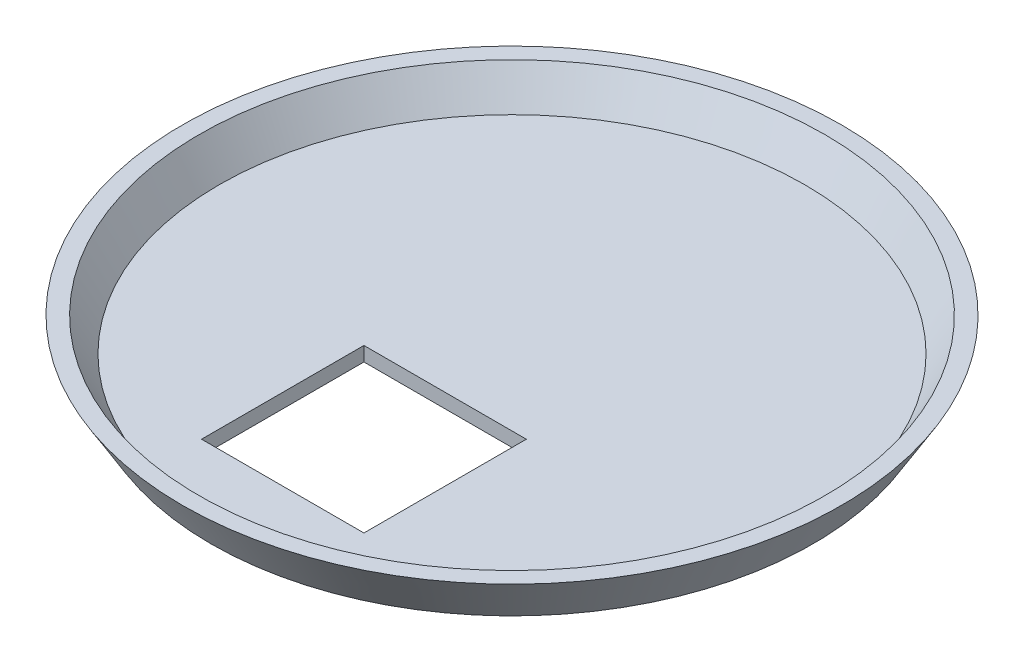
from build123d import *

# Parameters (mm, degrees)
SKETCH2_W          = 34
SKETCH2_H          = 34
CUT_EXTRUDE1_DEPTH = 99.091793744


with BuildPart() as part:
    # Sketch1 → Revolve1 (revolve)
    with BuildSketch(Plane.XY):
        Polygon((0, 0), (63, 0), (69, 10), (65.501428863, 10), (61.301428863, 3), (0, 3), align=None)
    revolve(axis=Axis((0, 0, 0), (0, 1, 0)))

    # Sketch2 → Cut-Extrude1 (cut, through all)
    with BuildSketch(Plane.XZ):
        with Locations((0, 31)):
            Rectangle(SKETCH2_W, SKETCH2_H)
    extrude(amount=-CUT_EXTRUDE1_DEPTH, mode=Mode.SUBTRACT)


solid = part.part
